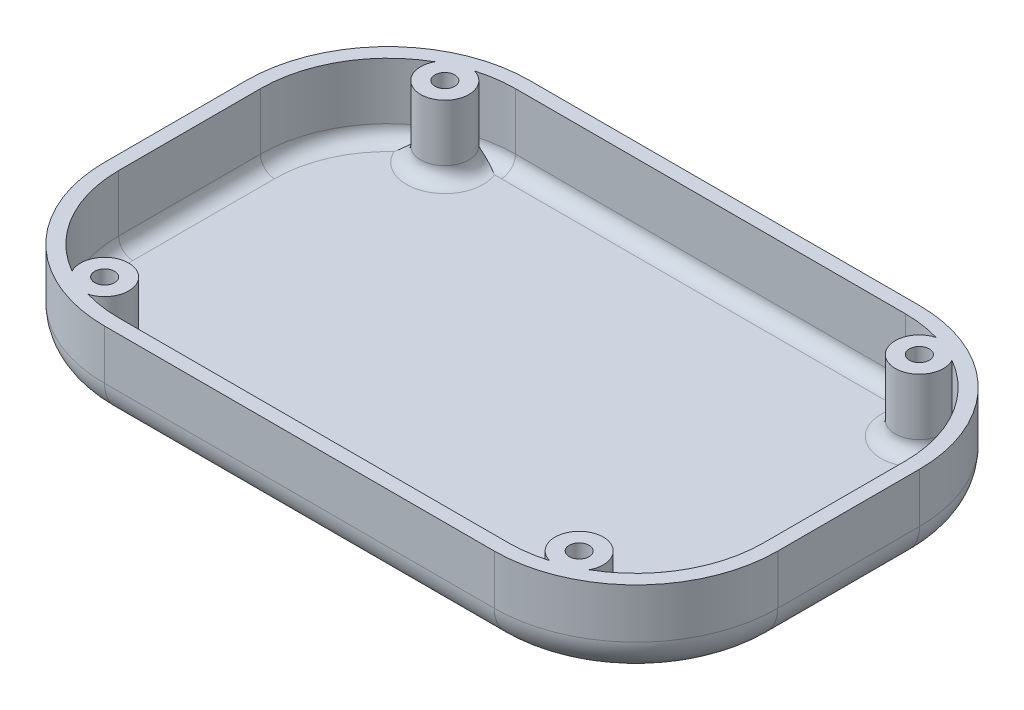
from build123d import *

# Parameters (mm, degrees)
BOSS_EXTRUDE1_DEPTH = 2
BOSS_EXTRUDE2_START = 10
SKETCH1_3_R         = 1.4
BOSS_EXTRUDE2_DEPTH = 10
FILLET1_R           = 5
FILLET2_R           = 2


with BuildPart() as part:
    # Sketch1 → Boss-Extrude1 (new body)
    with BuildSketch(Plane(origin=(0, 0, 0), x_dir=(1, 0, 0), z_dir=(0, 1, 0))):
        with BuildLine():
            ThreePointArc((47.5, 10), (41.642135624, 24.142135624), (27.5, 30))
            Line((27.5, 30), (-27.5, 30))
            ThreePointArc((-27.5, 30), (-41.642135624, 24.142135624), (-47.5, 10))
            Line((-47.5, 10), (-47.5, -10))
            ThreePointArc((-47.5, -10), (-41.642135624, -24.142135624), (-27.5, -30))
            Line((-27.5, -30), (27.5, -30))
            ThreePointArc((27.5, -30), (41.642135624, -24.142135624), (47.5, -10))
            Line((47.5, -10), (47.5, 10))
        make_face()
    extrude(amount=-BOSS_EXTRUDE1_DEPTH)

    # Sketch1<3> → Boss-Extrude2 (add)
    with BuildSketch(Plane(origin=(0, 0, 0), x_dir=(1, 0, 0), z_dir=(0, 1, 0)).offset(BOSS_EXTRUDE2_START)):
        with BuildLine():
            ThreePointArc((47.5, 10), (41.642135624, 24.142135624), (27.5, 30))
            Line((27.5, 30), (-27.5, 30))
            ThreePointArc((-27.5, 30), (-41.642135624, 24.142135624), (-47.5, 10))
            Line((-47.5, 10), (-47.5, -10))
            ThreePointArc((-47.5, -10), (-41.642135624, -24.142135624), (-27.5, -30))
            Line((-27.5, -30), (27.5, -30))
            ThreePointArc((27.5, -30), (41.642135624, -24.142135624), (47.5, -10))
            Line((47.5, -10), (47.5, 10))
        make_face()
        with BuildLine():
            ThreePointArc((45.5, -10), (43.082931227, -19.009564605), (36.480860625, -25.599491737))
            ThreePointArc((36.480860625, -25.599491737), (32.144927221, -20.873339482), (32.562014691, -27.273563826))
            ThreePointArc((32.562014691, -27.273563826), (30.056936754, -27.817465432), (27.5, -28))
            Line((27.5, -28), (-27.5, -28))
            ThreePointArc((-27.5, -28), (-30.056936754, -27.817465432), (-32.562014691, -27.273563826))
            ThreePointArc((-32.562014691, -27.273563826), (-32.144927221, -20.873339482), (-36.480860625, -25.599491737))
            ThreePointArc((-36.480860625, -25.599491737), (-43.082931227, -19.009564605), (-45.5, -10))
            Line((-45.5, -10), (-45.5, 10))
            ThreePointArc((-45.5, 10), (-43.082931227, 19.009564605), (-36.480860625, 25.599491737))
            ThreePointArc((-36.480860625, 25.599491737), (-32.144927221, 20.873339482), (-32.562014691, 27.273563826))
            ThreePointArc((-32.562014691, 27.273563826), (-30.056936754, 27.817465432), (-27.5, 28))
            Line((-27.5, 28), (27.5, 28))
            ThreePointArc((27.5, 28), (30.056936754, 27.817465432), (32.562014691, 27.273563826))
            ThreePointArc((32.562014691, 27.273563826), (32.144927221, 20.873339482), (36.480860625, 25.599491737))
            ThreePointArc((36.480860625, 25.599491737), (43.082931227, 19.009564605), (45.5, 10))
            Line((45.5, 10), (45.5, -10))
        make_face(mode=Mode.SUBTRACT)
        with Locations((33.480589606, 24)):
            Circle(SKETCH1_3_R, mode=Mode.SUBTRACT)
        with Locations((-33.480589606, 24)):
            Circle(SKETCH1_3_R, mode=Mode.SUBTRACT)
        with Locations((-33.480589606, -24)):
            Circle(SKETCH1_3_R, mode=Mode.SUBTRACT)
        with Locations((33.480589606, -24)):
            Circle(SKETCH1_3_R, mode=Mode.SUBTRACT)
    extrude(amount=-BOSS_EXTRUDE2_DEPTH)

    # Fillet1
    fillet1_edges = [part.edges().sort_by_distance(p)[0] for p in [
        (47.5, -2, 0),
        (41.642135624, -2, -24.142135624),
        (0, -2, -30),
        (-41.642135624, -2, -24.142135624),
        (-47.5, -2, 0),
        (-41.642135624, -2, 24.142135624),
        (0, -2, 30),
        (41.642135624, -2, 24.142135624),
    ]]
    fillet(fillet1_edges, radius=FILLET1_R)

    # Fillet2
    fillet2_edges = [part.edges().sort_by_distance(p)[0] for p in [
        (45.5, 0, 0),
        (43.082931227, 0, 19.009564605),
        (32.144927221, 0, 20.873339482),
        (30.056936754, 0, 27.817465432),
        (0, 0, 28),
        (-30.056936754, 0, 27.817465432),
        (-32.144927221, 0, 20.873339482),
        (-43.082931227, 0, 19.009564605),
        (-45.5, 0, 0),
        (-43.082931227, 0, -19.009564605),
        (-32.144927221, 0, -20.873339482),
        (-30.056936754, 0, -27.817465432),
        (0, 0, -28),
        (30.056936754, 0, -27.817465432),
        (32.144927221, 0, -20.873339482),
        (43.082931227, 0, -19.009564605),
    ]]
    fillet(fillet2_edges, radius=FILLET2_R)


solid = part.part
